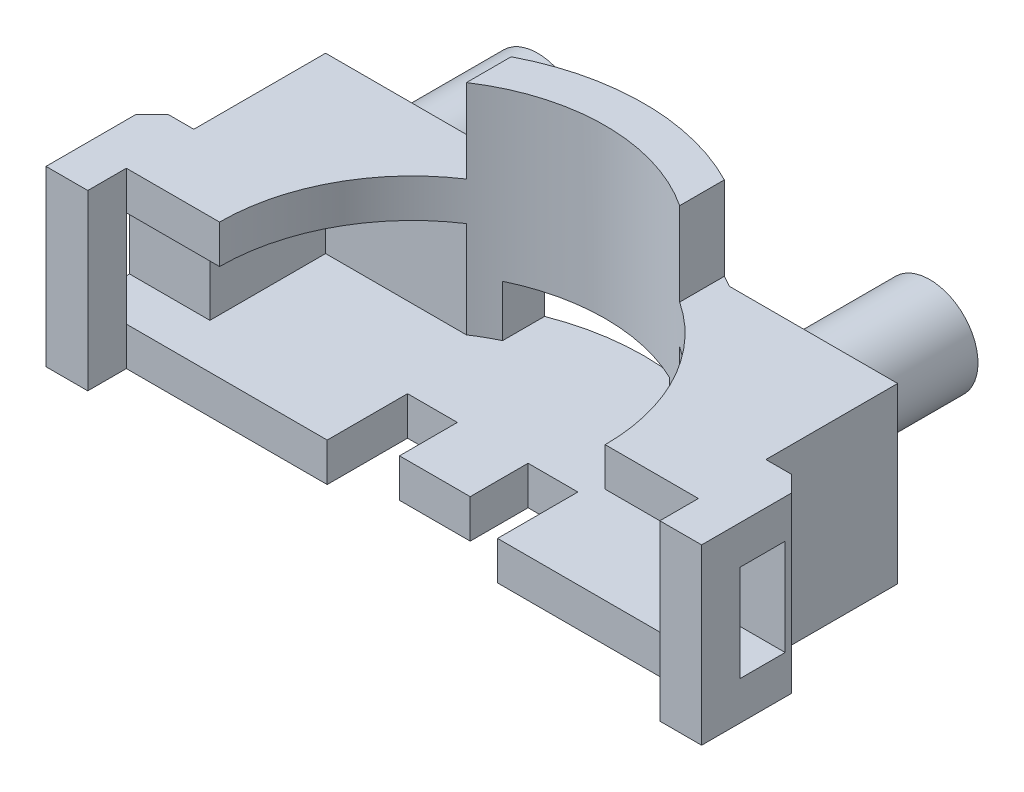
from build123d import *

# Parameters (mm, degrees)
SKETCH1_W                = 17.8
SKETCH1_H                = 6.2
BOSS_EXTRUDE1_DEPTH      = 5.4
SHELL1_T                 = -1.2
SKETCH2_W                = 6
SKETCH2_H                = 4.2
REVOLVE1_DEPTH           = 8
SKETCH5_W                = 1.864108749
SKETCH5_H                = 2.6
CUT_EXTRUDE1_DEPTH       = 5.4
SKETCH6_W                = 5.2
SKETCH6_H                = 1.6
CUT_EXTRUDE2_DEPTH       = 2.7
SKETCH7_R                = 1.5
BOSS_EXTRUDE2_DEPTH      = 3.8
SKETCH9_W                = 5.3
SKETCH9_H                = 2.5
CUT_EXTRUDE3_DEPTH       = 5
SKETCH12_W               = 1.4
SKETCH12_H               = 3
CUT_EXTRUDE4_DEPTH       = 5
BOSS_EXTRUDE5_DEPTH      = 1.3
CHAMFER1_SIZE            = 0.5
CHAMFER1_OF_MIRROR1_SIZE = 0.5
SKETCH13_W               = 2.2
SKETCH13_H               = 1.8
BOSS_EXTRUDE6_DEPTH      = 1.2


# Read off the part's stored shape, not the designer's step: Revolve1
with BuildPart() as part:
    # Sketch1 → Boss-Extrude1 (new body)
    with BuildSketch(Plane(origin=(0, 0, 0), x_dir=(1, 0, 0), z_dir=(0, 1, 0))):
        Rectangle(SKETCH1_W, SKETCH1_H)
    extrude(amount=BOSS_EXTRUDE1_DEPTH)

    # Shell1
    shell1_openings = [part.faces().sort_by_distance(p)[0] for p in [
        (0, 2.7, 3.1),
    ]]
    offset(amount=SHELL1_T, openings=shell1_openings, kind=Kind.INTERSECTION)

    # Sketch2 → Cut-Revolve1 (revolve, cut)
    with BuildSketch(Plane.XY.offset(3.1)):
        with Locations((3, 3.3)):
            Rectangle(SKETCH2_W, SKETCH2_H)
    revolve(axis=Axis((0, 1.2, 3.1), (0, 1, 0)), mode=Mode.SUBTRACT)

    # Revolve1 outline → Revolve1 (add)
    with BuildSketch(Plane(origin=(0, 0, 0), x_dir=(1, 0, 0), z_dir=(0, 1, 0))):
        with BuildLine():
            Line((-5.180733539, 1.9), (-3.31662479, 1.9))
            ThreePointArc((-3.31662479, 1.9), (0, 2.9), (3.31662479, 1.9))
            Line((3.31662479, 1.9), (5.180733539, 1.9))
            ThreePointArc((5.180733539, 1.9), (0, 4.1), (-5.180733539, 1.9))
        make_face()
    extrude(amount=REVOLVE1_DEPTH)

    # Sketch5 → Cut-Extrude1 (cut)
    with BuildSketch(Plane.XY.offset(-1.9)):
        with Locations((-4.248679165, 6.7)):
            Rectangle(SKETCH5_W, SKETCH5_H)
        with Locations((4.248679165, 6.7)):
            Rectangle(SKETCH5_W, SKETCH5_H)
    extrude(amount=-CUT_EXTRUDE1_DEPTH, mode=Mode.SUBTRACT)

    # Sketch6 → Cut-Extrude2 (cut, symmetric)
    with BuildSketch(Plane(origin=(0, 0, -3.1), x_dir=(-1, 0, 0), z_dir=(0, 0, -1))):
        with Locations((0, 2)):
            Rectangle(SKETCH6_W, SKETCH6_H)
    extrude(amount=CUT_EXTRUDE2_DEPTH, both=True, mode=Mode.SUBTRACT)

    # Sketch7 → Boss-Extrude2 (add)
    with BuildSketch(Plane(origin=(0, 0, -3.1), x_dir=(-1, 0, 0), z_dir=(0, 0, -1))):
        with Locations(Location((6.1, 3.4, 0), (0, 0, 180))):
            Circle(SKETCH7_R)
        with Locations(Location((-6.1, 3.4, 0), (0, 0, 180))):
            Circle(SKETCH7_R)
    extrude(amount=BOSS_EXTRUDE2_DEPTH)

    # Sketch9 → Cut-Extrude3 (cut, symmetric)
    with BuildSketch(Plane(origin=(0, 1.2, 0), x_dir=(1, 0, 0), z_dir=(0, 1, 0))):
        with Locations((0, -1.85)):
            Rectangle(SKETCH9_W, SKETCH9_H)
    extrude(amount=CUT_EXTRUDE3_DEPTH, both=True, mode=Mode.SUBTRACT)

    # Sketch12 → Cut-Extrude4 (cut, symmetric)
    with BuildSketch(Plane(origin=(8.9, 0, 0), x_dir=(0, 0, -1), z_dir=(1, 0, 0))):
        with Locations((-2.4, 2.7)):
            Rectangle(SKETCH12_W, SKETCH12_H)
    cut_extrude4 = extrude(amount=CUT_EXTRUDE4_DEPTH, both=True, mode=Mode.SUBTRACT)

    # Sketch11 → Boss-Extrude5 (add)
    with BuildSketch(Plane(origin=(8.9, 0, 0), x_dir=(0, 0, -1), z_dir=(1, 0, 0))):
        Polygon((-1, 0), (-1, 5.4), (-3.1, 5.4), (-3.1, 4.2), (-1.7, 4.2), (-1.7, 1.2), (-3.1, 1.2), (-3.1, 0), align=None)
        Polygon((-3.1, 4.2), (-3.1, 5.4), (-4.3, 5.4), (-4.3, 0), (-3.1, 0), (-3.1, 1.2), align=None)
    boss_extrude5 = extrude(amount=BOSS_EXTRUDE5_DEPTH)

    # Chamfer1
    chamfer1_edges = [part.edges().sort_by_distance(p)[0] for p in [
        (10.2, 2.7, 1),
    ]]
    chamfer(chamfer1_edges, length=CHAMFER1_SIZE)

    # Mirror1: Cut-Extrude4, Boss-Extrude5 across plane
    add(cut_extrude4.mirror(Plane(origin=(0, 0, 0), x_dir=(0, 0, 1), z_dir=(1, 0, 0))), mode=Mode.SUBTRACT)
    add(boss_extrude5.mirror(Plane(origin=(0, 0, 0), x_dir=(0, 0, 1), z_dir=(1, 0, 0))))

    # Chamfer1 of Mirror1
    chamfer1_of_mirror1_edges = [part.edges().sort_by_distance(p)[0] for p in [
        (-10.2, 2.7, 1),
    ]]
    chamfer(chamfer1_of_mirror1_edges, length=CHAMFER1_OF_MIRROR1_SIZE)

    # Sketch13 → Boss-Extrude6 (add)
    with BuildSketch(Plane(origin=(0, 1.2, 0), x_dir=(1, 0, 0), z_dir=(0, 1, 0))):
        with Locations((0, -1.5)):
            Rectangle(SKETCH13_W, SKETCH13_H)
    extrude(amount=-BOSS_EXTRUDE6_DEPTH)


solid = part.part
